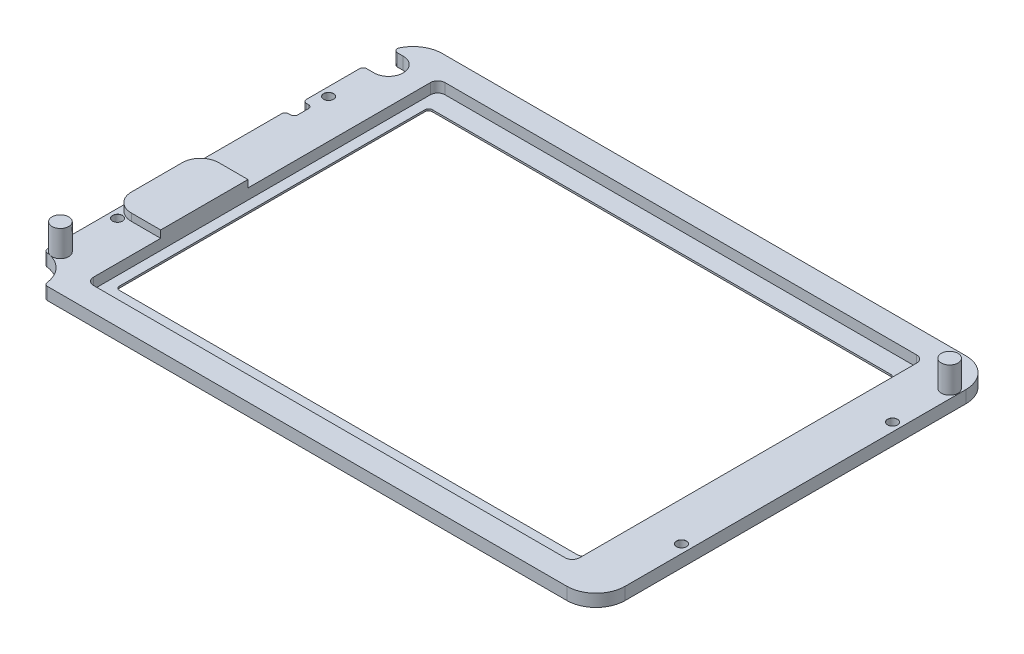
from build123d import *

# Parameters (mm, degrees)
SKETCH1_W                            = 159.7
SKETCH1_H                            = 109.7
BOSS_EXTRUDE1_DEPTH                  = 3.4
SKETCH5_W                            = 128
SKETCH5_H                            = 86
CUT_EXTRUDE1_DEPTH                   = 97.933508138
SKETCH6_W                            = 133.6
SKETCH6_H                            = 96.6
CUT_EXTRUDE2_DEPTH                   = 2.9
F_2_7_2_7_DIAMETER_HOLE1_D           = 2.7
F_2_7_2_7_DIAMETER_HOLE1_CSINK_D     = 2.75
F_2_7_2_7_DIAMETER_HOLE1_CSINK_ANGLE = 90
SKETCH10_R                           = 1.35
BOSS_EXTRUDE3_DEPTH                  = 0.5
M2X0_4_TAPPED_HOLE1_D                = 1.6
M2X0_4_TAPPED_HOLE1_CSINK_D          = 2.05
M2X0_4_TAPPED_HOLE1_CSINK_ANGLE      = 90
SKETCH7_W                            = 143
SKETCH7_H                            = 102.2
SKETCH7_W_2                          = 141
SKETCH7_H_2                          = 100.2
BOSS_EXTRUDE2_DEPTH                  = 0.5
SKETCH17_R                           = 1.5
CUT_EXTRUDE6_DEPTH                   = 2
SKETCH15_W                           = 2.5
SKETCH15_H                           = 4.9
CUT_EXTRUDE5_DEPTH                   = 97.952333649
CUT_EXTRUDE4_DEPTH                   = 97.952333649
SKETCH8_R                            = 8
CUT_EXTRUDE3_DEPTH                   = 97.952333649
SKETCH14_R                           = 2.3
BOSS_EXTRUDE4_DEPTH                  = 7.2
FILLET1_R                            = 8
FILLET2_R                            = 2
FILLET3_R                            = 3
FILLET4_R                            = 1
FILLET5_R                            = 2
FILLET6_R                            = 1
SKETCH16_W                           = 13.05
SKETCH16_H                           = 24
BOSS_EXTRUDE5_DEPTH                  = 2
FILLET7_R                            = 5


with BuildPart() as part:
    # Sketch1 → Boss-Extrude1 (new body)
    with BuildSketch(Plane(origin=(0, 0, 0), x_dir=(1, 0, 0), z_dir=(0, 1, 0))):
        Rectangle(SKETCH1_W, SKETCH1_H)
    extrude(amount=BOSS_EXTRUDE1_DEPTH)

    # Sketch5 → Cut-Extrude1 (cut, through all)
    with BuildSketch(Plane.XZ):
        Rectangle(SKETCH5_W, SKETCH5_H)
    extrude(amount=-CUT_EXTRUDE1_DEPTH, mode=Mode.SUBTRACT)

    # Sketch6 → Cut-Extrude2 (cut)
    with BuildSketch(Plane(origin=(0, 3.4, 0), x_dir=(1, 0, 0), z_dir=(0, 1, 0))):
        Rectangle(SKETCH6_W, SKETCH6_H)
    extrude(amount=-CUT_EXTRUDE2_DEPTH, mode=Mode.SUBTRACT)

    # Ø2.7 (2.7) Diameter Hole1 (through all)
    with Locations(Plane(origin=(0, 3.4, 0), x_dir=(1, 0, 0), z_dir=(0, 1, 0))):
        with Locations((-77.5, 29), (-77.5, -29), (77.5, 29), (77.5, -29)):
            CounterSinkHole(F_2_7_2_7_DIAMETER_HOLE1_D / 2, F_2_7_2_7_DIAMETER_HOLE1_CSINK_D / 2, counter_sink_angle=F_2_7_2_7_DIAMETER_HOLE1_CSINK_ANGLE)

    # Sketch10 → Boss-Extrude3 (add)
    with BuildSketch(Plane.XZ):
        with Locations(Location((-77.35, 44.85, 0), (0, 0, 90))):
            Circle(SKETCH10_R)
        with Locations(Location((77.35, -44.85, 0), (0, 0, 90))):
            Circle(SKETCH10_R)
    extrude(amount=BOSS_EXTRUDE3_DEPTH)

    # M2x0.4 Tapped Hole1 (through all)
    with Locations(Plane(origin=(0, -0.5, 0), x_dir=(-1, 0, 0), z_dir=(0, -1, 0))):
        with Locations((-77.35, 44.85), (77.35, -44.85)):
            CounterSinkHole(M2X0_4_TAPPED_HOLE1_D / 2, M2X0_4_TAPPED_HOLE1_CSINK_D / 2, counter_sink_angle=M2X0_4_TAPPED_HOLE1_CSINK_ANGLE)

    # Sketch7 → Boss-Extrude2 (add)
    with BuildSketch(Plane.XZ):
        Rectangle(SKETCH7_W, SKETCH7_H)
        Rectangle(SKETCH7_W_2, SKETCH7_H_2, mode=Mode.SUBTRACT)
    extrude(amount=BOSS_EXTRUDE2_DEPTH)

    # Sketch17 → Cut-Extrude6 (cut)
    with BuildSketch(Plane.XZ):
        with Locations(Location((-76.85, 0, 0), (0, 0, 270))):
            Circle(SKETCH17_R)
        with Locations(Location((76.85, 0, 0), (0, 0, 270))):
            Circle(SKETCH17_R)
    extrude(amount=-CUT_EXTRUDE6_DEPTH, mode=Mode.SUBTRACT)

    # Sketch15 → Cut-Extrude5 (cut, through all)
    with BuildSketch(Plane(origin=(0, 3.4, 0), x_dir=(1, 0, 0), z_dir=(0, 1, 0))):
        with Locations((-78.6, 21.85)):
            Rectangle(SKETCH15_W, SKETCH15_H)
    extrude(amount=-CUT_EXTRUDE5_DEPTH, mode=Mode.SUBTRACT)

    # Sketch9 → Cut-Extrude4 (cut, through all)
    with BuildSketch(Plane(origin=(0, 3.4, 0), x_dir=(1, 0, 0), z_dir=(0, 1, 0))):
        with BuildLine():
            Line((-76.85, 40.85), (-79.85, 40.85))
            Line((-79.85, 40.85), (-79.85, 48.85))
            Line((-79.85, 48.85), (-76.85, 48.85))
            ThreePointArc((-76.85, 48.85), (-72.85, 44.85), (-76.85, 40.85))
        make_face()
    extrude(amount=-CUT_EXTRUDE4_DEPTH, mode=Mode.SUBTRACT)

    # Sketch8 → Cut-Extrude3 (cut, through all)
    with BuildSketch(Plane(origin=(0, 3.4, 0), x_dir=(1, 0, 0), z_dir=(0, 1, 0))):
        with Locations((-79.85, -54.85)):
            Circle(SKETCH8_R)
    extrude(amount=-CUT_EXTRUDE3_DEPTH, mode=Mode.SUBTRACT)

    # Sketch14 → Boss-Extrude4 (add)
    with BuildSketch(Plane(origin=(0, 3.4, 0), x_dir=(1, 0, 0), z_dir=(0, 1, 0))):
        with Locations(Location((-77.35, -44.85, 0), (0, 0, 270))):
            Circle(SKETCH14_R)
        with Locations(Location((77.35, 44.85, 0), (0, 0, 270))):
            Circle(SKETCH14_R)
    extrude(amount=BOSS_EXTRUDE4_DEPTH)

    # Fillet1
    # the kernel refuses this fillet: 8 mm, written as the material it takes off along each edge
    with BuildSketch(Plane(origin=(79.85, -20, 54.85), x_dir=(0, 0, -1), z_dir=(0, 1, 0)), Plane(origin=(79.85, -20, -54.85), x_dir=(-1, 0, 0), z_dir=(0, 1, 0))) as fillet1_piece_1:
        with BuildLine():
            CenterArc((FILLET1_R, FILLET1_R), FILLET1_R, 180, 90)
            Line((0, FILLET1_R), (-FILLET1_R * 0.02, FILLET1_R))
            Line((-FILLET1_R * 0.02, FILLET1_R), (-FILLET1_R * 0.02, -FILLET1_R * 0.02))
            Line((-FILLET1_R * 0.02, -FILLET1_R * 0.02), (FILLET1_R, -FILLET1_R * 0.02))
            Line((FILLET1_R, -FILLET1_R * 0.02), (FILLET1_R, 0))
        make_face()
    extrude(amount=43.4, mode=Mode.SUBTRACT)
    with BuildSketch(Plane(origin=(-79.85, -19.364916731, -54.85), x_dir=(1, 0, 0), z_dir=(0, 1, 0))) as fillet1_piece_2:
        with BuildLine():
            CenterArc((7.745966692, -8), FILLET1_R, 90, 75.522487814)
            Line((0, -6), (-0.154919334, -5.96))
            ThreePointArc((-0.154919334, -5.96), (-0.16, -3), (-0.16, 0))
            Line((-0.16, 0), (0, 0.16))
            Line((0, 0.16), (7.745966692, 0.16))
            Line((7.745966692, 0.16), (7.745966692, 0))
        make_face()
    extrude(amount=42.129833462, mode=Mode.SUBTRACT)

    # Fillet2
    fillet2_edges = [part.edges().sort_by_distance(p)[0] for p in [
        (70.5, -0.25, 50.1),
        (-70.5, -0.25, 50.1),
        (-70.5, -0.25, -50.1),
        (70.5, -0.25, -50.1),
    ]]
    fillet(fillet2_edges, radius=FILLET2_R)

    # Fillet3
    fillet3_edges = [part.edges().sort_by_distance(p)[0] for p in [
        (71.5, -0.25, -51.1),
        (71.5, -0.25, 51.1),
        (-71.5, -0.25, 51.1),
        (-71.5, -0.25, -51.1),
    ]]
    fillet(fillet3_edges, radius=FILLET3_R)

    # Fillet4
    fillet4_edges = [part.edges().sort_by_distance(p)[0] for p in [
        (-64, 0.25, 43),
        (64, 0.25, 43),
        (-64, 0.25, -43),
        (64, 0.25, -43),
    ]]
    fillet(fillet4_edges, radius=FILLET4_R)

    # Fillet5
    fillet5_edges = [part.edges().sort_by_distance(p)[0] for p in [
        (66.8, 1.95, -48.3),
        (66.8, 1.95, 48.3),
        (-66.8, 1.95, 48.3),
        (-66.8, 1.95, -48.3),
    ]]
    fillet(fillet5_edges, radius=FILLET5_R)

    # Fillet6
    fillet6_edges = [part.edges().sort_by_distance(p)[0] for p in [
        (-79.85, 1.7, -19.4),
        (-79.85, 1.7, -24.3),
        (-77.35, 1.7, -24.3),
        (-77.35, 1.7, -19.4),
        (-79.85, 1.7, -40.85),
        (-79.85, 1.7, -48.85),
        (-71.85, 1.7, 54.85),
        (-79.85, 1.7, 46.85),
    ]]
    fillet(fillet6_edges, radius=FILLET6_R)

    # Sketch16 → Boss-Extrude5 (add)
    with BuildSketch(Plane(origin=(0, 3.4, 0), x_dir=(1, 0, 0), z_dir=(0, 1, 0))):
        with Locations((-73.325, -15.85)):
            Rectangle(SKETCH16_W, SKETCH16_H)
    extrude(amount=BOSS_EXTRUDE5_DEPTH)

    # Fillet7
    # the kernel refuses this fillet: 5 mm, written as the material it takes off along each edge
    with BuildSketch(Plane(origin=(-79.85, 3.4, 3.85), x_dir=(0, 0, 1), z_dir=(0, 1, 0))) as fillet7_piece_1:
        with BuildLine():
            CenterArc((FILLET7_R, FILLET7_R), FILLET7_R, 180, 90)
            Line((0, FILLET7_R), (0, 0))
            Line((0, 0), (FILLET7_R, 0))
        make_face()
    extrude(amount=14.5, mode=Mode.SUBTRACT)
    with BuildSketch(Plane(origin=(-79.85, 3.4, 27.85), x_dir=(0, 0, -1), z_dir=(0, 1, 0))) as fillet7_piece_2:
        with BuildLine():
            CenterArc((FILLET7_R, -FILLET7_R), FILLET7_R, 90, 90)
            Line((0, -FILLET7_R), (0, 0))
            Line((0, 0), (FILLET7_R, 0))
        make_face()
    extrude(amount=14.5, mode=Mode.SUBTRACT)


solid = part.part
